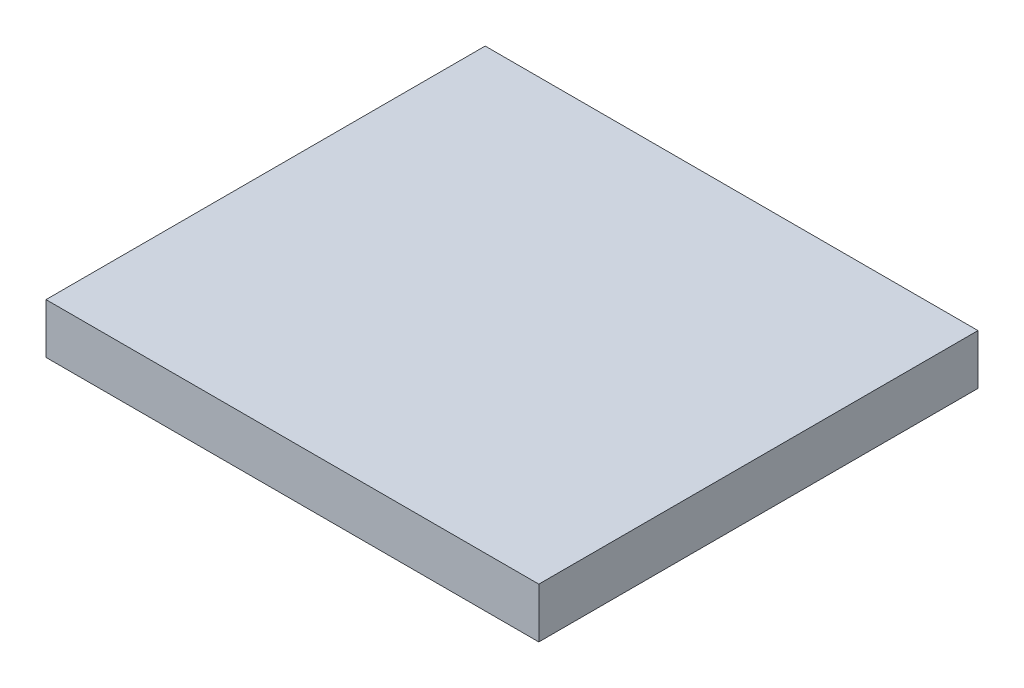
from build123d import *

# Parameters (mm, degrees)
SKETCH_1_W             = 14.75576732
SKETCH_1_H             = 13.149930719
SM_BASE_FLANGE_1_DEPTH = 1.5


# Sheet-metal steps are written as plain solids
with BuildPart() as part:
    # Sketch 1 → Базовая кромка1 (new body)
    with BuildSketch(Plane(origin=(0, 0, 0), x_dir=(1, 0, 0), z_dir=(0, 1, 0))):
        with Locations((7.37788366, 6.57496536)):
            Rectangle(SKETCH_1_W, SKETCH_1_H)
    extrude(amount=-SM_BASE_FLANGE_1_DEPTH)


solid = part.part
